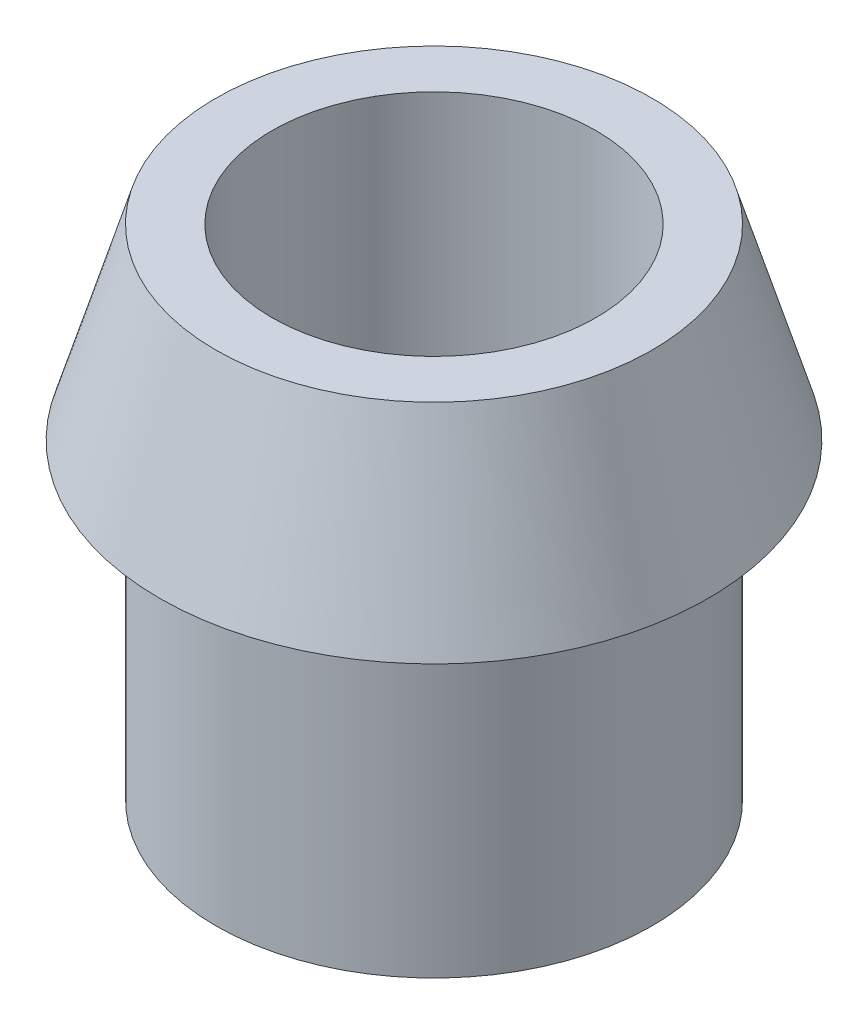
from build123d import *

# Parameters (mm, degrees)
SKETCH1_R           = 3.5
BOSS_EXTRUDE1_DEPTH = 5
SKETCH2_R           = 5
BOSS_EXTRUDE2_DEPTH = 3
CHAMFER1_SIZE       = 5
CHAMFER1_SIZE_2     = 1.5
SKETCH3_R           = 2.6
CUT_EXTRUDE1_DEPTH  = 20


with BuildPart() as part:
    # Sketch1 → Boss-Extrude1 (new body)
    with BuildSketch(Plane(origin=(0, 0, 0), x_dir=(1, 0, 0), z_dir=(0, 1, 0))):
        with Locations(Location((0, 0, 0), (0, 0, 270))):
            Circle(SKETCH1_R)
    extrude(amount=BOSS_EXTRUDE1_DEPTH)

    # Sketch2 → Boss-Extrude2 (add)
    with BuildSketch(Plane(origin=(0, 5, 0), x_dir=(1, 0, 0), z_dir=(0, 1, 0))):
        with Locations(Location((0, 0, 0), (0, 0, 270))):
            Circle(SKETCH2_R)
    extrude(amount=BOSS_EXTRUDE2_DEPTH)

    # Chamfer1
    # the kernel refuses this chamfer: 5, 1.5 mm, written as the material it takes off along each edge
    with BuildSketch(Plane(origin=(0, 8, 0), x_dir=(0, 0, 1), z_dir=(-1, 0, 0))) as chamfer1_piece_1:
        Polygon((5, -CHAMFER1_SIZE), (5 - CHAMFER1_SIZE_2, 0), (5, 0), align=None)
    revolve(axis=Axis((0, 8, 0), (0, 1, 0)), mode=Mode.SUBTRACT)

    # Sketch3 → Cut-Extrude1 (cut)
    with BuildSketch(Plane(origin=(0, 8, 0), x_dir=(1, 0, 0), z_dir=(0, 1, 0))):
        with Locations(Location((0, 0, 0), (0, 0, 270))):
            Circle(SKETCH3_R)
    extrude(amount=-CUT_EXTRUDE1_DEPTH, mode=Mode.SUBTRACT)


solid = part.part
